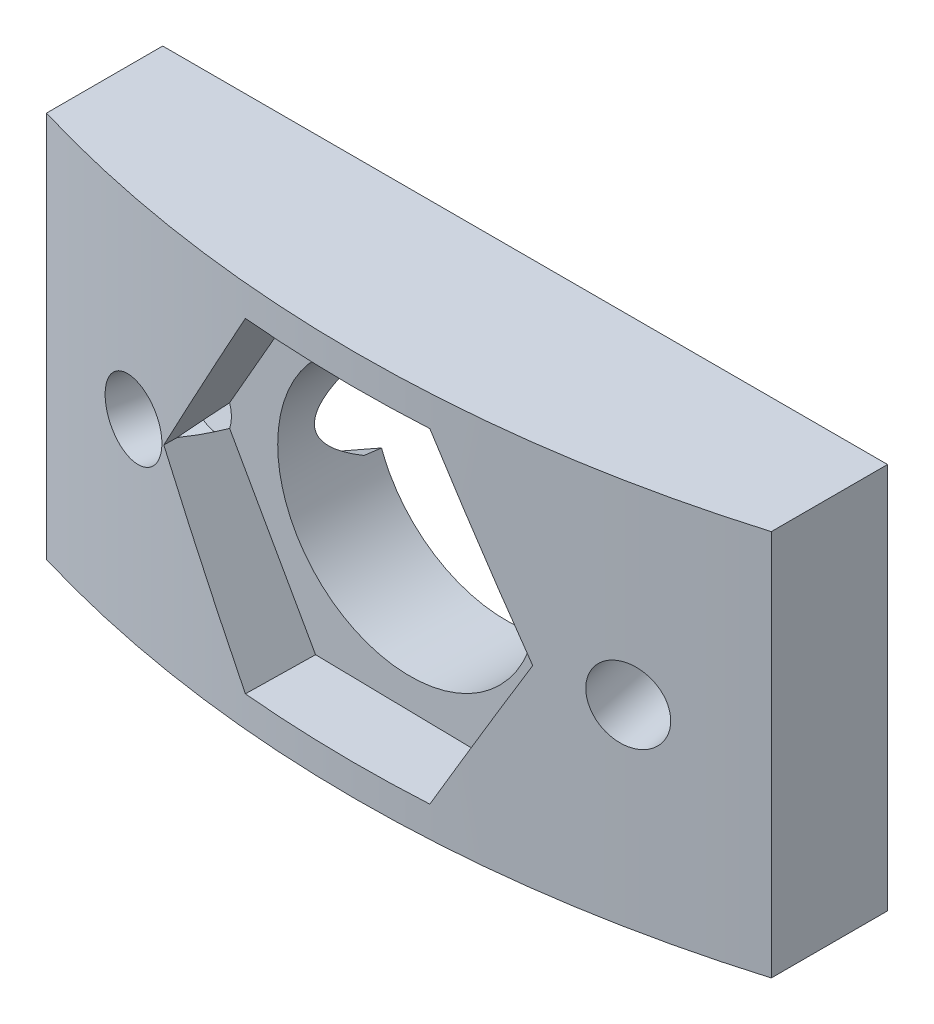
from build123d import *

# Parameters (mm, degrees)
SKETCH1_W           = 38.1
SKETCH1_H           = 20.32
BOSS_EXTRUDE1_DEPTH = 8.89
CUT_EXTRUDE3_START  = -20.32
CUT_EXTRUDE3_DEPTH  = 20.32
CUT_EXTRUDE5_DEPTH  = 42.856889745
SKETCH15_R          = 6.9596
CUT_EXTRUDE7_DEPTH  = 31.005753887
CUT_EXTRUDE8_DEPTH  = 3.81


# Read off the part's stored shape, not the designer's step: Cut-Extrude3
with BuildPart() as part:
    # Sketch1 → Boss-Extrude1 (new body)
    with BuildSketch(Plane.XY):
        Rectangle(SKETCH1_W, SKETCH1_H)
    extrude(amount=BOSS_EXTRUDE1_DEPTH)

    # Cut-Extrude3 outline → Cut-Extrude3 (cut)
    with BuildSketch(Plane(origin=(0, 10.16, 0), x_dir=(1, 0, 0), z_dir=(0, 1, 0)).offset(CUT_EXTRUDE3_START)):
        with BuildLine():
            ThreePointArc((19.05, -6.110642457), (9.62584189, -8.191501824), (0, -8.89))
            Line((0, -8.89), (19.05, -8.89))
            Line((19.05, -8.89), (19.05, -6.110642457))
        make_face()
        with BuildLine():
            ThreePointArc((0, -8.89), (-9.62584189, -8.191501824), (-19.05, -6.110642457))
            Line((-19.05, -6.110642457), (-19.05, -8.89))
            Line((-19.05, -8.89), (0, -8.89))
        make_face()
    extrude(amount=CUT_EXTRUDE3_DEPTH, mode=Mode.SUBTRACT)

    # Sketch12 → #6 Clearance Hole2 (revolve, cut)
    with BuildSketch(Plane(origin=(13.00764722, 0, 7.608858571), x_dir=(0.9807852804032313, 0, -0.19509032201612442), z_dir=(0, 1, 0))):
        Polygon((0, 0), (0, 13.840824014), (1.89865, 12.7), (1.89865, 0), align=None)
    f_6_clearance_hole2 = revolve(axis=Axis((14.246470765, 0, 13.836845101), (-0.19509032201612442, 0, -0.9807852804032313)), mode=Mode.SUBTRACT)

    # Sketch14 → Cut-Extrude5 (cut, through all)
    with BuildSketch(Plane(origin=(12.313906035, -17.145, 4.121186114), x_dir=(-0.9807852804032313, 0, 0.19509032201612445), z_dir=(-0.19509032201612445, 0, -0.9807852804032313))):
        Polygon((0, 21.764379504), (-4.0005, 19.454689752), (-4.0005, 14.835310248), (0, 12.525620496), (4.0005, 14.835310248), (4.0005, 19.454689752), align=None)
    cut_extrude5 = extrude(amount=CUT_EXTRUDE5_DEPTH, mode=Mode.SUBTRACT)

    # Mirror1: #6 Clearance Hole2, Cut-Extrude5 across plane
    add(f_6_clearance_hole2.mirror(Plane(origin=(0, 0, 0), x_dir=(0, 0, 1), z_dir=(1, 0, 0))), mode=Mode.SUBTRACT)
    add(cut_extrude5.mirror(Plane(origin=(0, 0, 0), x_dir=(0, 0, 1), z_dir=(1, 0, 0))), mode=Mode.SUBTRACT)

    # Sketch15 → Cut-Extrude7 (cut, through all)
    with BuildSketch(Plane(origin=(-1.163639199, -10.16, 8.879845075), x_dir=(-0.9998476951563913, 0, -0.017452406437284837), z_dir=(0.017452406437284837, 0, -0.9998476951563913))):
        with Locations(Location((0, 10.16, 0), (0, 0, 180))):
            Circle(SKETCH15_R)
    extrude(amount=CUT_EXTRUDE7_DEPTH, mode=Mode.SUBTRACT)

    # Sketch16 → Cut-Extrude8 (cut)
    with BuildSketch(Plane(origin=(-1.163639199, -10.16, 8.879845075), x_dir=(-0.9998476951563913, 0, -0.017452406437284837), z_dir=(0.017452406437284837, 0, -0.9998476951563913))):
        Polygon((-4.934670486, 18.7071), (-9.869340972, 10.16), (-4.934670486, 1.6129), (4.934670486, 1.6129), (9.869340972, 10.16), (4.934670486, 18.7071), align=None)
    extrude(amount=CUT_EXTRUDE8_DEPTH, mode=Mode.SUBTRACT)


solid = part.part
